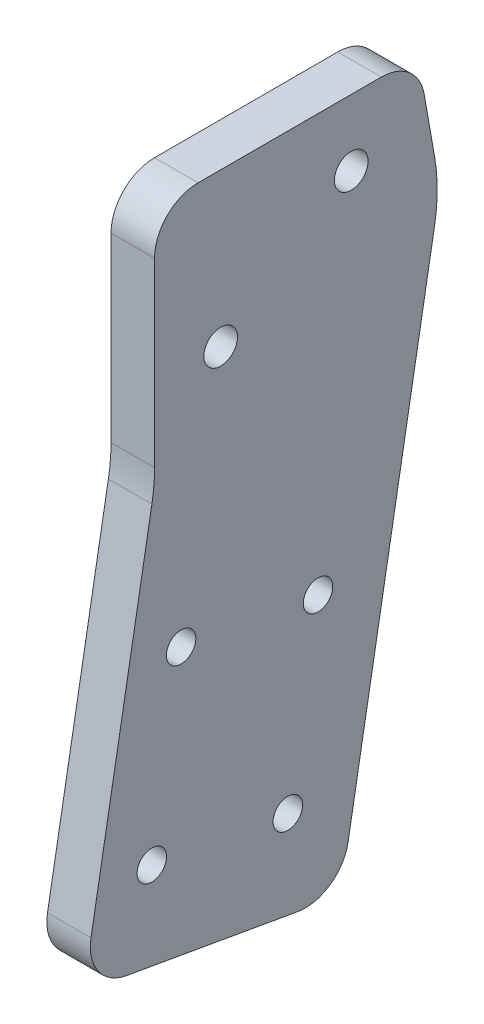
from build123d import *

# Parameters (mm, degrees)
BOSS_EXTRUDE1_DEPTH                               = 6.35
FILLET1_R                                         = 25.4
CSK_FOR_6_FLAT_HEAD_MACHINE_SCREW_100_D           = 4.3053
CSK_FOR_6_FLAT_HEAD_MACHINE_SCREW_100_CSINK_D     = 7.0866
CSK_FOR_6_FLAT_HEAD_MACHINE_SCREW_100_CSINK_ANGLE = 100
CSK_FOR_8_FLAT_HEAD_MACHINE_SCREW_100_D           = 4.9149
CSK_FOR_8_FLAT_HEAD_MACHINE_SCREW_100_CSINK_D     = 8.4328
CSK_FOR_8_FLAT_HEAD_MACHINE_SCREW_100_CSINK_ANGLE = 100
FILLET2_R                                         = 6.35


with BuildPart() as part:
    # Sketch1 → Boss-Extrude1 (new body)
    with BuildSketch(Plane.ZY.offset(-5.035827965)):
        Polygon((-147.77562455, 230.070458845), (-162.269800873, 312.271017517), (-159.04513305, 330.559017517), (-120.626834873, 330.559017517), (-120.626834873, 295.511176933), (-110.25444916, 236.686454414), align=None)
    extrude(amount=BOSS_EXTRUDE1_DEPTH)

    # Fillet1
    fillet1_edges = [part.edges().sort_by_distance(p)[0] for p in [
        (1.860827965, 295.511176933, -120.626834873),
        (1.860827965, 312.271017517, -162.269800873),
    ]]
    fillet(fillet1_edges, radius=FILLET1_R)

    # CSK for #6 Flat Head Machine Screw (100)1 (through all)
    with Locations(Plane.ZY.offset(1.314172035)):
        with Locations((-124.504125043, 273.139415456), (-144.485224025, 269.724179148), (-140.075144867, 244.324179148), (-120.227402214, 247.716621746)):
            CounterSinkHole(CSK_FOR_6_FLAT_HEAD_MACHINE_SCREW_100_D / 2, CSK_FOR_6_FLAT_HEAD_MACHINE_SCREW_100_CSINK_D / 2, counter_sink_angle=CSK_FOR_6_FLAT_HEAD_MACHINE_SCREW_100_CSINK_ANGLE)

    # CSK for #8 Flat Head Machine Screw (100)1 (through all)
    with Locations(Plane.ZY.offset(1.314172035)):
        with Locations((-149.328834873, 320.907017517), (-130.278834873, 308.207017517)):
            CounterSinkHole(CSK_FOR_8_FLAT_HEAD_MACHINE_SCREW_100_D / 2, CSK_FOR_8_FLAT_HEAD_MACHINE_SCREW_100_CSINK_D / 2, counter_sink_angle=CSK_FOR_8_FLAT_HEAD_MACHINE_SCREW_100_CSINK_ANGLE)

    # Fillet2
    fillet2_edges = [part.edges().sort_by_distance(p)[0] for p in [
        (1.860827965, 330.559017517, -120.626834873),
        (1.860827965, 330.559017517, -159.04513305),
        (1.860827965, 236.686454414, -110.25444916),
        (1.860827965, 230.070458845, -147.77562455),
    ]]
    fillet(fillet2_edges, radius=FILLET2_R)


solid = part.part
